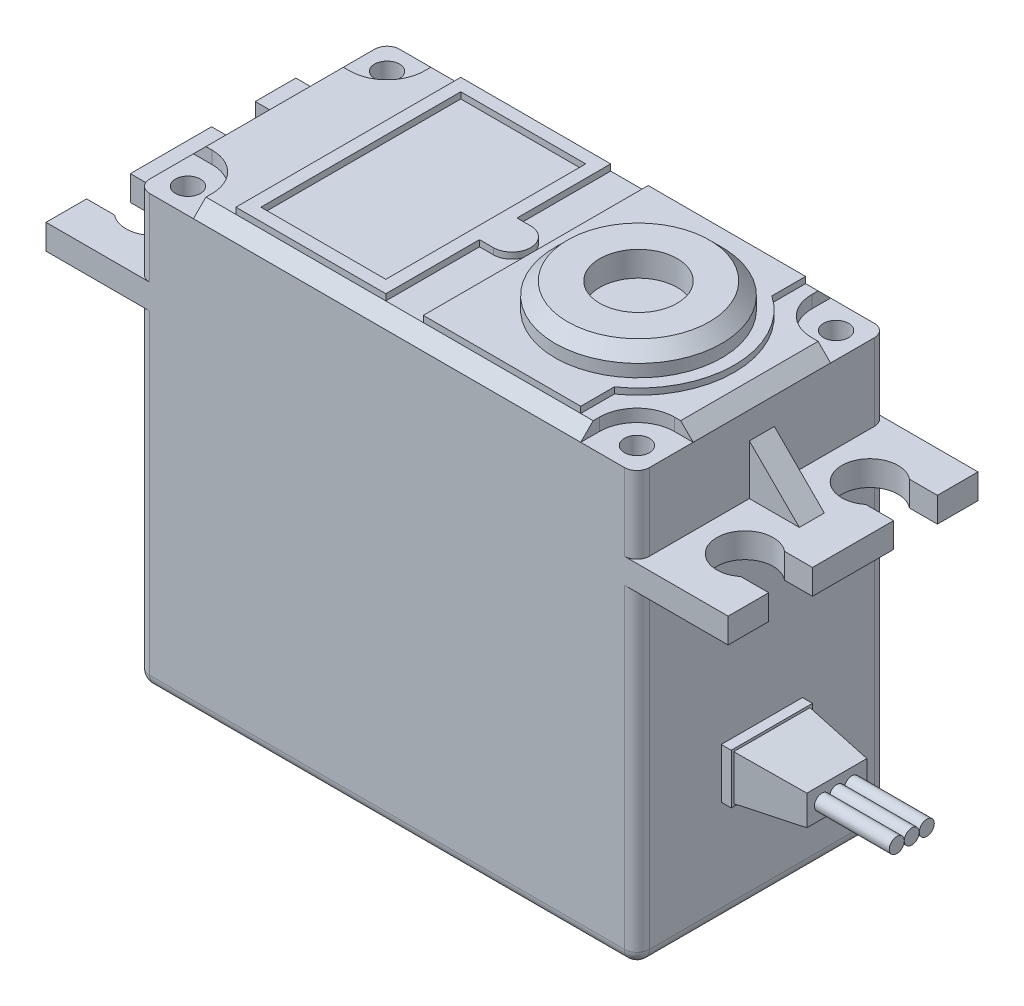
from build123d import *

# Parameters (mm, degrees)
SKETCH_1_W           = 40
SKETCH_1_H           = 20
EXTRUDE_1_DEPTH      = 35.4
SKETCH_2_W           = 7.3
SKETCH_2_H           = 2
EXTRUDE_2_DEPTH      = 20
SKETCH_3_R           = 2.25
CUT_EXTRUDE_1_DEPTH  = 35.4
SKETCH_4_R           = 6.675
EXTRUDE_3_DEPTH      = 0.5
SKETCH_4_3_R         = 6.675
EXTRUDE_4_DEPTH      = 2.5
SKETCH_4_5_W         = 12
SKETCH_4_5_H         = 18
SKETCH_4_5_W_2       = 10
SKETCH_4_5_H_2       = 16
EXTRUDE_2_2_DEPTH    = 0.5
EXTRUDE_6_DEPTH      = 0.5
SKETCH_13_W          = 6.5
SKETCH_13_H          = 4
EXTRUDE_8_DEPTH      = 6
CUT_EXTRUDE_5_DEPTH  = 49.551647758
CUT_EXTRUDE_6_DEPTH  = 6
SKETCH_17_R          = 0.6
EXTRUDE_11_DEPTH     = 6
EXTRUDE_11_2_DEPTH   = 6
EXTRUDE_11_3_DEPTH   = 6
SKETCH_18_W          = 2
SKETCH_18_H          = 4
EXTRUDE_12_DEPTH     = 4
CUT_EXTRUDE_7_DEPTH  = 4
CHAMFER_2_SIZE       = 1
SKETCH_21_R          = 3.1
CUT_EXTRUDE_8_DEPTH  = 2
SKETCH_23_W          = 4.5
SKETCH_23_H          = 4.5
CUT_EXTRUDE_9_DEPTH  = 1
FILLET_3_R           = 3
SKETCH_24_R          = 1
CUT_EXTRUDE_10_DEPTH = 2
CHAMFER_3_SIZE       = 1
FILLET_6_R           = 1
FILLET_7_R           = 1


with BuildPart() as part:
    # ｽｹｯﾁ1 → ﾎﾞｽ - 押し出し1 (new body)
    with BuildSketch(Plane(origin=(0, 0, 0), x_dir=(1, 0, 0), z_dir=(0, 1, 0))):
        Rectangle(SKETCH_1_W, SKETCH_1_H)
    extrude_1 = extrude(amount=EXTRUDE_1_DEPTH)

    # ｽｹｯﾁ2 → Extrude 2 (add)
    with BuildSketch(Plane.XY.offset(10)):
        with Locations((23.65, 27.25)):
            Rectangle(SKETCH_2_W, SKETCH_2_H)
        with Locations((-23.65, 27.25)):
            Rectangle(SKETCH_2_W, SKETCH_2_H)
    extrude(amount=-EXTRUDE_2_DEPTH)

    # ｽｹｯﾁ3 → ｶｯﾄ - 押し出し1 (cut)
    with BuildSketch(Plane(origin=(0, 28.25, 0), x_dir=(1, 0, 0), z_dir=(0, 1, 0))):
        with Locations((23.65, -5)):
            Circle(SKETCH_3_R)
        with BuildLine():
            Line((25.064213562, -6.75), (27.3, -6.75))
            Line((27.3, -6.75), (27.3, -3.25))
            Line((27.3, -3.25), (25.064213562, -3.25))
            ThreePointArc((25.064213562, -3.25), (25.680330086, -4.030330086), (25.9, -5))
            ThreePointArc((25.9, -5), (25.680330086, -5.969669914), (25.064213562, -6.75))
        make_face()
        with Locations((23.65, 5)):
            Circle(SKETCH_3_R)
        with BuildLine():
            Line((27.3, 3.25), (27.3, 6.75))
            Line((27.3, 6.75), (25.064213562, 6.75))
            ThreePointArc((25.064213562, 6.75), (25.680330086, 5.969669914), (25.9, 5))
            ThreePointArc((25.9, 5), (25.680330086, 4.030330086), (25.064213562, 3.25))
            Line((25.064213562, 3.25), (27.3, 3.25))
        make_face()
        with Locations((-23.65, -5)):
            Circle(SKETCH_3_R)
        with BuildLine():
            Line((-27.3, -3.25), (-27.3, -6.75))
            Line((-27.3, -6.75), (-25.064213562, -6.75))
            ThreePointArc((-25.064213562, -6.75), (-25.9, -5), (-25.064213562, -3.25))
            Line((-25.064213562, -3.25), (-27.3, -3.25))
        make_face()
        with Locations((-23.65, 5)):
            Circle(SKETCH_3_R)
        with BuildLine():
            Line((-27.3, 6.75), (-27.3, 3.25))
            Line((-27.3, 3.25), (-25.064213562, 3.25))
            ThreePointArc((-25.064213562, 3.25), (-25.9, 5), (-25.064213562, 6.75))
            Line((-25.064213562, 6.75), (-27.3, 6.75))
        make_face()
    extrude(amount=-CUT_EXTRUDE_1_DEPTH, mode=Mode.SUBTRACT)

    # ｽｹｯﾁ4 → ﾎﾞｽ - 押し出し3 (add)
    with BuildSketch(Plane(origin=(0, 35.4, 0), x_dir=(1, 0, 0), z_dir=(0, 1, 0))):
        with BuildLine():
            Line((1.9, -9), (14.5, -9))
            Line((14.5, -9), (14.5, -6.306493844))
            ThreePointArc((14.5, -6.306493844), (17.800447192, 0), (14.5, 6.306493844))
            Line((14.5, 6.306493844), (14.5, 9))
            Line((14.5, 9), (1.9, 9))
            Line((1.9, 9), (1.9, -9))
        make_face()
        with Locations(Location((10.125, 0, 0), (0, 0, 270))):
            Circle(SKETCH_4_R, mode=Mode.SUBTRACT)
    extrude(amount=EXTRUDE_3_DEPTH)

    # ｽｹｯﾁ4<3> → ﾎﾞｽ - 押し出し4 (add)
    with BuildSketch(Plane(origin=(0, 35.4, 0), x_dir=(1, 0, 0), z_dir=(0, 1, 0))):
        with Locations(Location((10.125, 0, 0), (0, 0, 270))):
            Circle(SKETCH_4_3_R)
    extrude(amount=EXTRUDE_4_DEPTH)

    # ｽｹｯﾁ4<5> → Extrude 2 2 (add)
    with BuildSketch(Plane(origin=(0, 35.4, 0), x_dir=(1, 0, 0), z_dir=(0, 1, 0))):
        with Locations((-7.1, 0)):
            Rectangle(SKETCH_4_5_W, SKETCH_4_5_H)
        with Locations((-7.1, 0)):
            Rectangle(SKETCH_4_5_W_2, SKETCH_4_5_H_2, mode=Mode.SUBTRACT)
    extrude(amount=EXTRUDE_2_2_DEPTH)

    # ｽｹｯﾁ4<6> → ﾎﾞｽ - 押し出し6 (add)
    with BuildSketch(Plane(origin=(0, 35.4, 0), x_dir=(1, 0, 0), z_dir=(0, 1, 0))):
        with BuildLine():
            Line((-1.1, 1.5), (-1.1, -1.5))
            Line((-1.1, -1.5), (0, -1.5))
            ThreePointArc((0, -1.5), (1.5, 0), (0, 1.5))
            Line((0, 1.5), (-1.1, 1.5))
        make_face()
    extrude(amount=EXTRUDE_6_DEPTH)

    # ｽｹｯﾁ13 → ﾎﾞｽ - 押し出し8 (add)
    with BuildSketch(Plane(origin=(20, 0, 0), x_dir=(0, 0, -1), z_dir=(1, 0, 0))):
        with Locations((0, 10.330544448)):
            Rectangle(SKETCH_13_W, SKETCH_13_H)
    extrude(amount=EXTRUDE_8_DEPTH)

    # ｽｹｯﾁ14 → ｶｯﾄ - 押し出し5 (cut, through all)
    with BuildSketch(Plane.XY.offset(3.25)):
        Polygon((20.8, 8.530544448), (20.8, 8.330544448), (26, 8.330544448), (26, 9.130544448), align=None)
        Polygon((26, 12.330544448), (20.8, 12.330544448), (20.8, 12.130544448), (26, 11.530544448), align=None)
    extrude(amount=-CUT_EXTRUDE_5_DEPTH, mode=Mode.SUBTRACT)

    # ｽｹｯﾁ15 → ｶｯﾄ - 押し出し6 (cut)
    with BuildSketch(Plane.XZ.offset(-8.330544448)):
        Polygon((20.8, 3.25), (20.8, 3.05), (26, 2.4), (26, 3.25), align=None)
        Polygon((20.8, -3.05), (20.8, -3.25), (26, -3.25), (26, -2.4), align=None)
    extrude(amount=-CUT_EXTRUDE_6_DEPTH, mode=Mode.SUBTRACT)

    # ｽｹｯﾁ18 → ﾎﾞｽ - 押し出し12 (add)
    with BuildSketch(Plane.ZY.offset(20)):
        with Locations((0, 30.25)):
            Rectangle(SKETCH_18_W, SKETCH_18_H)
    extrude_12 = extrude(amount=EXTRUDE_12_DEPTH)

    # ｽｹｯﾁ19 → ｶｯﾄ - 押し出し7 (cut)
    with BuildSketch(Plane(origin=(0, 0, -1), x_dir=(-1, 0, 0), z_dir=(0, 0, -1))):
        Polygon((24, 28.25), (20, 32.25), (24, 32.25), align=None)
    cut_extrude_7 = extrude(amount=-CUT_EXTRUDE_7_DEPTH, mode=Mode.SUBTRACT)

    # ﾐﾗｰ5: ﾎﾞｽ - 押し出し1, ﾎﾞｽ - 押し出し12, ｶｯﾄ - 押し出し7 across plane
    add(extrude_1.mirror(Plane.ZY))
    add(extrude_12.mirror(Plane.ZY))
    add(cut_extrude_7.mirror(Plane.ZY), mode=Mode.SUBTRACT)

    # 面取り2
    chamfer_2_edges = [part.edges().sort_by_distance(p)[0] for p in [
        (10.125, 37.9, -6.675),
    ]]
    chamfer(chamfer_2_edges, length=CHAMFER_2_SIZE)

    # ｽｹｯﾁ21 → ｶｯﾄ - 押し出し8 (cut)
    with BuildSketch(Plane(origin=(0, 37.9, 0), x_dir=(1, 0, 0), z_dir=(0, 1, 0))):
        with Locations(Location((10.125, 0, 0), (0, 0, 270))):
            Circle(SKETCH_21_R)
    extrude(amount=-CUT_EXTRUDE_8_DEPTH, mode=Mode.SUBTRACT)

    # ｽｹｯﾁ23 → ｶｯﾄ - 押し出し9 (cut)
    with BuildSketch(Plane(origin=(0, 35.4, 0), x_dir=(1, 0, 0), z_dir=(0, 1, 0))):
        with Locations((-17.75, -7.75)):
            Rectangle(SKETCH_23_W, SKETCH_23_H)
        with Locations((-17.75, 7.75)):
            Rectangle(SKETCH_23_W, SKETCH_23_H)
        with Locations((17.75, 7.75)):
            Rectangle(SKETCH_23_W, SKETCH_23_H)
        with Locations((17.75, -7.75)):
            Rectangle(SKETCH_23_W, SKETCH_23_H)
    extrude(amount=-CUT_EXTRUDE_9_DEPTH, mode=Mode.SUBTRACT)

    # ﾌｨﾚｯﾄ3
    fillet_3_edges = [part.edges().sort_by_distance(p)[0] for p in [
        (-15.5, 34.9, 5.5),
        (-15.5, 34.9, -5.5),
        (15.5, 34.9, -5.5),
        (15.5, 34.9, 5.5),
    ]]
    fillet(fillet_3_edges, radius=FILLET_3_R)

    # ｽｹｯﾁ24 → ｶｯﾄ - 押し出し10 (cut)
    with BuildSketch(Plane(origin=(0, 34.4, 0), x_dir=(1, 0, 0), z_dir=(0, 1, 0))):
        with Locations(Location((-17.969669914, 7.969669914, 0), (0, 0, 270))):
            Circle(SKETCH_24_R)
        with Locations(Location((-17.969669914, -7.969669914, 0), (0, 0, 270))):
            Circle(SKETCH_24_R)
        with Locations(Location((17.969669914, -7.969669914, 0), (0, 0, 270))):
            Circle(SKETCH_24_R)
        with Locations(Location((17.969669914, 7.969669914, 0), (0, 0, 270))):
            Circle(SKETCH_24_R)
    extrude(amount=-CUT_EXTRUDE_10_DEPTH, mode=Mode.SUBTRACT)

    # 面取り3
    chamfer_3_edges = [part.edges().sort_by_distance(p)[0] for p in [
        (20, 35.4, 0),
        (0, 35.4, 10),
        (-20, 35.4, 0),
        (0, 35.4, -10),
    ]]
    chamfer(chamfer_3_edges, length=CHAMFER_3_SIZE - 0.0001)  # a hair under: the kernel refuses the full size

    # ﾌｨﾚｯﾄ6
    fillet_6_edges = [part.edges().sort_by_distance(p)[0] for p in [
        (20, 13.125, 10),
        (20, 31.325, 10),
        (-20, 13.125, 10),
        (-20, 31.325, 10),
        (-20, 13.125, -10),
        (-20, 31.325, -10),
        (20, 31.325, -10),
        (20, 13.125, -10),
    ]]
    fillet(fillet_6_edges, radius=FILLET_6_R)

    # ﾌｨﾚｯﾄ7
    fillet_7_edges = [part.edges().sort_by_distance(p)[0] for p in [
        (20, 0, 0),
        (-20, 0, 0),
        (0, 0, -10),
        (0, 0, 10),
        (19.707106781, 0, -9.707106781),
        (-19.707106781, 0, -9.707106781),
        (-19.707106781, 0, 9.707106781),
        (19.707106781, 0, 9.707106781),
    ]]
    fillet(fillet_7_edges, radius=FILLET_7_R)


with BuildPart() as body_2:
    # ｽｹｯﾁ17 → ﾎﾞｽ - 押し出し11 (new body)
    with BuildSketch(Plane(origin=(26, 0, 0), x_dir=(0, 0, -1), z_dir=(1, 0, 0))):
        with Locations((-1.2, 10.330544448)):
            Circle(SKETCH_17_R)
    extrude(amount=EXTRUDE_11_DEPTH)


with BuildPart() as body_3:
    # ｽｹｯﾁ17 → Extrude 11 2 (new body)
    with BuildSketch(Plane(origin=(26, 0, 0), x_dir=(0, 0, -1), z_dir=(1, 0, 0))):
        with Locations((0, 10.330544448)):
            Circle(SKETCH_17_R)
    extrude(amount=EXTRUDE_11_2_DEPTH)


with BuildPart() as body_4:
    # ｽｹｯﾁ17 → Extrude 11 3 (new body)
    with BuildSketch(Plane(origin=(26, 0, 0), x_dir=(0, 0, -1), z_dir=(1, 0, 0))):
        with Locations((1.2, 10.330544448)):
            Circle(SKETCH_17_R)
    extrude(amount=EXTRUDE_11_3_DEPTH)


solid = Compound([part.part, body_2.part, body_3.part, body_4.part])
